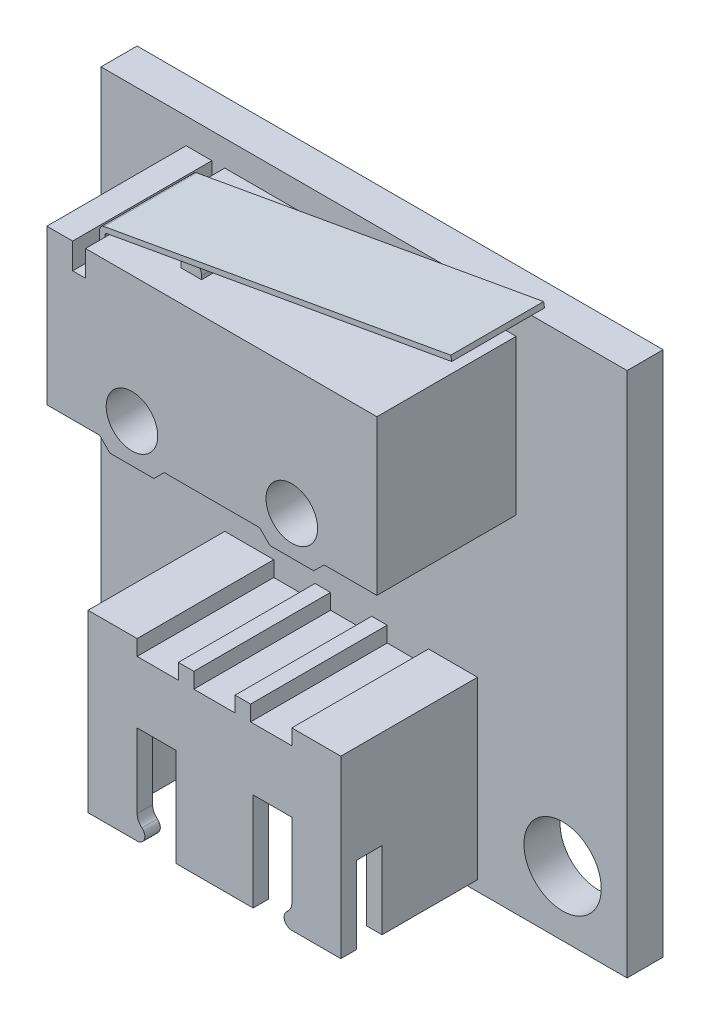
from build123d import *

# Parameters (mm, degrees)
SKETCH_1_W               = 20.4
SKETCH_1_H               = 20.4
SKETCH_1_R               = 1.5
EXTRUDE_1_DEPTH          = 1.4
EXTRUDE_START            = 0.5
SKETCH_2_W               = 9.8
SKETCH_2_H               = 6.8
EXTRUDE_2_DEPTH          = 5.3
SKETCH_3_W               = 0.6
SKETCH_3_H               = 1
CUT_EXTRUDE_1_DEPTH      = 3
SKETCH_3_3_W             = 1.5
SKETCH_3_3_H             = 0.6
CUT_EXTRUDE_2_DEPTH      = 3.8
SKETCH_3_4_W             = 8.6
SKETCH_3_4_H             = 3.1
CUT_EXTRUDE_3_DEPTH      = 5.2
CUT_EXTRUDE_4_DEPTH      = 0.3
CHAMFER_1_SIZE           = 0.3
SKETCH_5_R               = 0.3
EXTRUDE_3_DEPTH          = 0.6
FILLET_2_R               = 0.5
SKETCH_6_W               = 1.6
SKETCH_6_H               = 0.6
CUT_EXTRUDE_5_DEPTH      = 5.3
SKETCH_7_R               = 1
EXTRUDE_4_DEPTH          = 5.4
SKETCH_8_R               = 1
CUT_EXTRUDE_6_DEPTH      = 30.447071162
CUT_EXTRUDE_9_DEPTH      = 30.214380021
CUT_EXTRUDE_9_DEPTH_BACK = 30.214380021
SKETCH_10_W              = 0.5
SKETCH_10_H              = 1
EXTRUDE_5_DEPTH          = 1.8
EXTRUDE_6_DEPTH          = 1.5


with BuildPart() as part:
    # Эскиз1 → Бобышка-Вытянуть1 (new body)
    with BuildSketch(Plane.XY):
        with Locations((10.2, 10.2)):
            Rectangle(SKETCH_1_W, SKETCH_1_H)
        with Locations((17.9, 2.5)):
            Circle(SKETCH_1_R, mode=Mode.SUBTRACT)
        with Locations((2.5, 2.5)):
            Circle(SKETCH_1_R, mode=Mode.SUBTRACT)
    extrude(amount=EXTRUDE_1_DEPTH)

    # Эскиз8 → Вырез-Вытянуть6 (cut, through all)
    with BuildSketch(Plane.XY.offset(1.4)):
        with Locations(Location((13.3, 15, 0), (0, 0, 180))):
            Circle(SKETCH_8_R)
        with Locations(Location((7.1, 15, 0), (0, 0, 180))):
            Circle(SKETCH_8_R)
    extrude(amount=-CUT_EXTRUDE_6_DEPTH, mode=Mode.SUBTRACT)


with BuildPart() as body_2:
    # Эскиз2 → Бобышка-Вытянуть2 (new body)
    with BuildSketch(Plane.XY.offset(1.4).offset(EXTRUDE_START)):
        with Locations((10.2, 4.3)):
            Rectangle(SKETCH_2_W, SKETCH_2_H)
    extrude(amount=EXTRUDE_2_DEPTH)

    # Эскиз3 → Вырез-Вытянуть1 (cut)
    with BuildSketch(Plane.XZ.offset(-0.9)):
        with Locations((5.6, 6.1)):
            Rectangle(SKETCH_3_W, SKETCH_3_H)
        with Locations((14.8, 6.1)):
            Rectangle(SKETCH_3_W, SKETCH_3_H)
    extrude(amount=-CUT_EXTRUDE_1_DEPTH, mode=Mode.SUBTRACT)

    # Эскиз3<3> → Вырез-Вытянуть2 (cut)
    with BuildSketch(Plane.XZ.offset(-0.9)):
        with Locations((7.95, 6.9)):
            Rectangle(SKETCH_3_3_W, SKETCH_3_3_H)
        with Locations((12.45, 6.9)):
            Rectangle(SKETCH_3_3_W, SKETCH_3_3_H)
    extrude(amount=-CUT_EXTRUDE_2_DEPTH, mode=Mode.SUBTRACT)

    # Эскиз3<4> → Вырез-Вытянуть3 (cut)
    with BuildSketch(Plane.XZ.offset(-0.9)):
        with Locations((10.2, 4.05)):
            Rectangle(SKETCH_3_4_W, SKETCH_3_4_H)
        Polygon((5.9, 6.6), (5.9, 5.6), (14.5, 5.6), (14.5, 6.6), (13.2, 6.6), (11.7, 6.6), (8.7, 6.6), (7.2, 6.6), align=None)
    extrude(amount=-CUT_EXTRUDE_3_DEPTH, mode=Mode.SUBTRACT)

    # Эскиз4 → Вырез-Вытянуть4 (cut)
    with BuildSketch(Plane.XZ.offset(-6.1)):
        Polygon((7.2, 4.2), (5.9, 4.2), (5.9, 2.5), (14.5, 2.5), (14.5, 4.2), align=None)
    extrude(amount=-CUT_EXTRUDE_4_DEPTH, mode=Mode.SUBTRACT)

    # Фаска1
    chamfer_1_edges = [body_2.edges().sort_by_distance(p)[0] for p in [
        (10.2, 6.1, 4.2),
    ]]
    chamfer(chamfer_1_edges, length=CHAMFER_1_SIZE - 0.0001)  # a hair under: the kernel refuses the full size

    # Эскиз5 → Бобышка-Вытянуть3 (add)
    with BuildSketch(Plane.XY.offset(7.2)):
        with Locations((13.2, 1.2)):
            Circle(SKETCH_5_R)
        with Locations((7.2, 1.2)):
            Circle(SKETCH_5_R)
    extrude(amount=-EXTRUDE_3_DEPTH)

    # Скругление2
    fillet_2_edges = [body_2.edges().sort_by_distance(p)[0] for p in [
        (13.2, 1.5, 6.9),
        (7.2, 1.5, 6.9),
    ]]
    fillet(fillet_2_edges, radius=FILLET_2_R)

    # Эскиз6 → Вырез-Вытянуть5 (cut)
    with BuildSketch(Plane.XY.offset(7.2)):
        with Locations((8, 7.4)):
            Rectangle(SKETCH_6_W, SKETCH_6_H)
        with Locations((10.2, 7.4)):
            Rectangle(SKETCH_6_W, SKETCH_6_H)
        with Locations((12.4, 7.4)):
            Rectangle(SKETCH_6_W, SKETCH_6_H)
    extrude(amount=-CUT_EXTRUDE_5_DEPTH, mode=Mode.SUBTRACT)


with BuildPart() as body_3:
    # Эскиз7 → Бобышка-Вытянуть4 (new body)
    # profile 1 of 5: a face of its own
    with BuildSketch(Plane.XY.offset(1.4).offset(EXTRUDE_START)):
        Polygon((3.8, 19.9), (3.8, 13.9), (5.85, 13.9), (8.35, 13.9), (12.05, 13.9), (14.55, 13.9), (16.6, 13.9), (16.6, 19.9), align=None)
        with Locations(Location((7.1, 15, 0), (0, 0, 180))):
            Circle(SKETCH_7_R, mode=Mode.SUBTRACT)
        with Locations(Location((13.3, 15, 0), (0, 0, 180))):
            Circle(SKETCH_7_R, mode=Mode.SUBTRACT)
    # profile 2 of 5: a face of its own
    with BuildSketch(Plane.XY.offset(1.4).offset(EXTRUDE_START)):
        Polygon((8.35, 13.9), (5.85, 13.9), (6.25, 13.5), (7.1, 13.5), (7.95, 13.5), align=None)
    # profile 3 of 5: a face of its own
    with BuildSketch(Plane.XY.offset(1.4).offset(EXTRUDE_START)):
        Polygon((14.55, 13.9), (12.05, 13.9), (12.45, 13.5), (14.15, 13.5), align=None)
    # profile 4 of 5: a face of its own
    with BuildSketch(Plane.XY.offset(1.4).offset(EXTRUDE_START)):
        Polygon((3.8, 19.9), (3.8, 13.9), (5.85, 13.9), (8.35, 13.9), (12.05, 13.9), (14.55, 13.9), (16.6, 13.9), (16.6, 19.9), align=None)
        with Locations(Location((7.1, 15, 0), (0, 0, 180))):
            Circle(SKETCH_7_R, mode=Mode.SUBTRACT)
        with Locations(Location((13.3, 15, 0), (0, 0, 180))):
            Circle(SKETCH_7_R, mode=Mode.SUBTRACT)
    # profile 5 of 5: a face of its own
    with BuildSketch(Plane.XY.offset(1.4).offset(EXTRUDE_START)):
        Polygon((3.8, 19.9), (3.8, 13.9), (5.85, 13.9), (8.35, 13.9), (12.05, 13.9), (14.55, 13.9), (16.6, 13.9), (16.6, 19.9), align=None)
        with Locations(Location((7.1, 15, 0), (0, 0, 180))):
            Circle(SKETCH_7_R, mode=Mode.SUBTRACT)
        with Locations(Location((13.3, 15, 0), (0, 0, 180))):
            Circle(SKETCH_7_R, mode=Mode.SUBTRACT)
    extrude(amount=EXTRUDE_4_DEPTH)

    # Эскиз10 → Вырез-Вытянуть9 (cut, two sides: drawn at the far end of the back side and taken through both)
    with BuildSketch(Plane.XY.offset(4.6).offset(-CUT_EXTRUDE_9_DEPTH_BACK)):
        with Locations((5.05, 19.4)):
            Rectangle(SKETCH_10_W, SKETCH_10_H)
    extrude(amount=CUT_EXTRUDE_9_DEPTH + CUT_EXTRUDE_9_DEPTH_BACK, mode=Mode.SUBTRACT)


with BuildPart() as body_4:
    # Эскиз11 → Бобышка-Вытянуть5 (new, symmetric)
    with BuildSketch(Plane.XY.offset(4.6)):
        with BuildLine():
            Line((5.232411488, 19.914724499), (18.6, 22.30311786))
            Line((18.6, 22.30311786), (18.564822975, 22.5))
            Line((18.564822975, 22.5), (5.114822975, 20.09688214))
            ThreePointArc((5.114822975, 20.09688214), (4.996645175, 20.0283834), (4.95, 19.9))
            Line((4.95, 19.9), (4.95, 19.896059192))
            Line((4.95, 19.896059192), (4.95, 19.05))
            Line((4.95, 19.05), (5.15, 19.05))
            Line((5.15, 19.05), (5.15, 19.81628343))
            ThreePointArc((5.15, 19.81628343), (5.173322587, 19.88047513), (5.232411488, 19.914724499))
        make_face()
    extrude(amount=EXTRUDE_5_DEPTH, both=True)


with BuildPart() as body_5:
    # Эскиз12 → Бобышка-Вытянуть6 (new, symmetric)
    with BuildSketch(Plane.XY.offset(4.6)):
        with BuildLine():
            Line((8.6, 20.038610472), (8.6, 19.438610472))
            ThreePointArc((8.6, 19.438610472), (8.2, 19.038610472), (7.8, 19.438610472))
            Line((7.8, 19.438610472), (7.8, 20.038610472))
            ThreePointArc((7.8, 20.038610472), (8.2, 20.438610472), (8.6, 20.038610472))
        make_face()
    extrude(amount=EXTRUDE_6_DEPTH, both=True)


solid = Compound([part.part, body_2.part, body_3.part, body_4.part, body_5.part])
